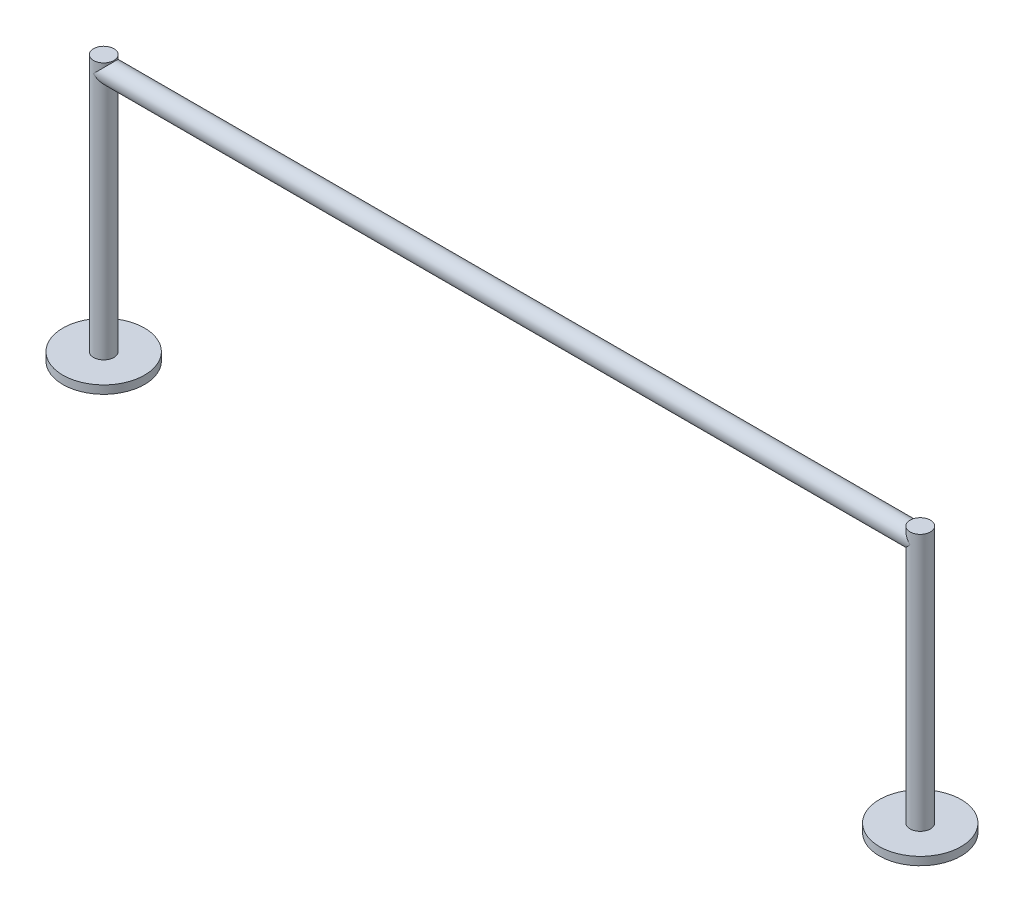
from build123d import *

# Parameters (mm, degrees)
SKETCH_1_R        = 50
EXTRUDE_1_DEPTH   = 10
EXTRUDE_1_2_DEPTH = 10
SKETCH_2_R        = 12.5
EXTRUDE_2_DEPTH   = 315
SKETCH_3_R        = 12.5
EXTRUDE_3_DEPTH   = 1000


with BuildPart() as part:
    # 草图1 → 凸台-拉伸1 (new body)
    with BuildSketch(Plane(origin=(0, 0, 0), x_dir=(1, 0, 0), z_dir=(0, 1, 0))):
        Circle(SKETCH_1_R)
    extrude(amount=EXTRUDE_1_DEPTH)



with BuildPart() as body_2:
    # 草图1 → Extrude 1 2 (new body)
    with BuildSketch(Plane(origin=(0, 0, 0), x_dir=(1, 0, 0), z_dir=(0, 1, 0))):
        with Locations((1000, 0)):
            Circle(SKETCH_1_R)
    extrude(amount=EXTRUDE_1_2_DEPTH)


with BuildPart() as part_1:
    add(part.part)

    add(body_2.part)  # 凸台-拉伸2 merges body 2
    # 草图2 → 凸台-拉伸2 (add)
    with BuildSketch(Plane(origin=(0, 10, 0), x_dir=(1, 0, 0), z_dir=(0, 1, 0))):
        Circle(SKETCH_2_R)
        with Locations((1000, 0)):
            Circle(SKETCH_2_R)
    extrude(amount=EXTRUDE_2_DEPTH)


with BuildPart() as extrude_3_tool:
    # 草图3 → 凸台-拉伸3 (new body)
    with BuildSketch(Plane(origin=(0, 0, 0), x_dir=(0, 0, -1), z_dir=(1, 0, 0))):
        with Locations((0, 311.132818199)):
            Circle(SKETCH_3_R)
    extrude(amount=EXTRUDE_3_DEPTH)


with BuildPart() as part_2:
    add(part_1.part)


with BuildPart() as part_3:
    # 凸台-拉伸3: joined with extrude_3_tool
    add(part_2.part.fuse(extrude_3_tool.part, tol=0.00001))


solid = part_3.part
